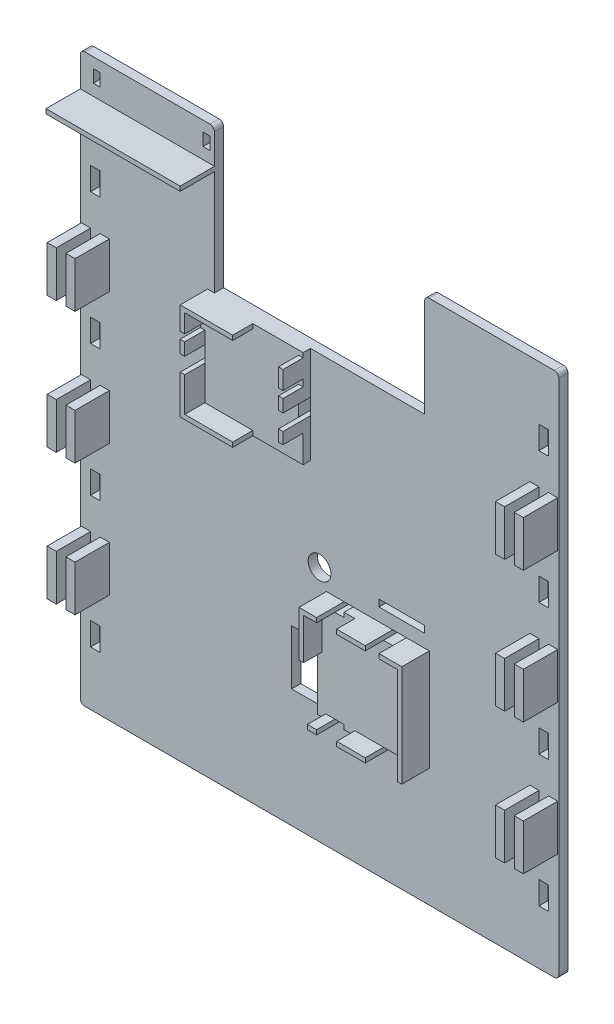
from build123d import *

# Parameters (mm, degrees)
SKETCH1_W               = 200
SKETCH1_H               = 230
BOSS_EXTRUDE1_DEPTH     = 70
SKETCH2_W               = 192
SKETCH2_H               = 222
CUT_EXTRUDE1_DEPTH      = 66
SKETCH4_W               = 196
SKETCH4_H               = 25
CUT_EXTRUDE3_DEPTH      = 10
SKETCH10_R              = 5
CUT_EXTRUDE8_DEPTH      = 167.075284133
SKETCH11_W              = 2
SKETCH11_H              = 10
BOSS_EXTRUDE2_DEPTH     = 20
SKETCH12_W              = 2
SKETCH12_H              = 5
CUT_EXTRUDE9_DEPTH      = 20
FILLET1_R               = 2.5
SKETCH13_W              = 2
SKETCH13_H              = 10
BOSS_EXTRUDE3_DEPTH     = 20
SKETCH14_W              = 2
SKETCH14_H              = 5
CUT_EXTRUDE10_DEPTH     = 20
FILLET2_R               = 2.5
SKETCH15_W              = 192
SKETCH15_H              = 66
CUT_EXTRUDE11_DEPTH     = 267.458251889
BOSS_EXTRUDE4_DEPTH     = 2
SKETCH18_R              = 5
CUT_EXTRUDE12_DEPTH     = 248.638849941
SKETCH19_R              = 5
CUT_EXTRUDE13_DEPTH     = 248.638849941
SKETCH20_R              = 5
CUT_EXTRUDE14_DEPTH     = 248.638849941
BOSS_EXTRUDE5_START     = 2
BOSS_EXTRUDE5_DEPTH     = 2
SKETCH21_W              = 20
SKETCH21_H              = 10
CUT_EXTRUDE15_DEPTH     = 248.638849941
SKETCH22_W              = 92
SKETCH22_H              = 45
CUT_EXTRUDE16_DEPTH     = 10
SKETCH24_R              = 5.1
CUT_EXTRUDE18_DEPTH     = 242.091269025
FILLET3_R               = 20
FILLET4_R               = 20
SKETCH31_W              = 4
SKETCH31_H              = 230
CUT_EXTRUDE24_DEPTH     = 168.705098312
SKETCH33_W              = 15
SKETCH33_H              = 20
BOSS_EXTRUDE7_DEPTH     = 4
SKETCH34_W              = 4
SKETCH34_H              = 23.75
BOSS_EXTRUDE8_DEPTH     = 4.2
SKETCH35_W              = 4
SKETCH35_H              = 47.5
BOSS_EXTRUDE9_DEPTH     = 4.2
SKETCH37_W              = 15
SKETCH37_H              = 20
BOSS_EXTRUDE10_DEPTH    = 4
SKETCH39_W              = 4
SKETCH39_H              = 47.5
BOSS_EXTRUDE11_DEPTH    = 4.2
SKETCH32_W              = 4
SKETCH32_H              = 230
CUT_EXTRUDE25_DEPTH     = 168.824432071
SKETCH40_W              = 4
SKETCH40_H              = 230
BOSS_EXTRUDE12_DEPTH    = 4.5
MIRROR8_COPY_1_SKETCH_W = 15
MIRROR8_COPY_1_SKETCH_H = 20
MIRROR8_COPY_1_DEPTH    = 4
MIRROR9_COPY_1_SKETCH_W = 4
MIRROR9_COPY_1_SKETCH_H = 47.5
MIRROR9_COPY_1_DEPTH    = 4.2
MIRROR9_COPY_2_SKETCH_W = 15
MIRROR9_COPY_2_SKETCH_H = 20
MIRROR9_COPY_2_DEPTH    = 4
MIRROR9_COPY_3_SKETCH_W = 4
MIRROR9_COPY_3_SKETCH_H = 23.75
MIRROR9_COPY_3_DEPTH    = 4.2
MIRROR9_COPY_4_SKETCH_W = 15
MIRROR9_COPY_4_SKETCH_H = 20
MIRROR9_COPY_4_DEPTH    = 4
MIRROR9_COPY_5_SKETCH_W = 15
MIRROR9_COPY_5_SKETCH_H = 20
MIRROR9_COPY_5_DEPTH    = 4
MIRROR9_COPY_6_SKETCH_W = 15
MIRROR9_COPY_6_SKETCH_H = 20
MIRROR9_COPY_6_DEPTH    = 4
SKETCH65_W              = 45
SKETCH65_H              = 42.5
SKETCH65_W_2            = 41
SKETCH65_H_2            = 38.5
BOSS_EXTRUDE23_DEPTH    = 12
CUT_EXTRUDE39_DEPTH     = 8.8
SKETCH67_W              = 2
SKETCH67_H              = 3
CUT_EXTRUDE40_DEPTH     = 8.8
SKETCH68_W              = 22
SKETCH68_H              = 2
SKETCH68_W_2            = 2
SKETCH68_H_2            = 3
CUT_EXTRUDE41_DEPTH     = 8.8
SKETCH69_W              = 2
SKETCH69_H              = 7
CUT_EXTRUDE42_DEPTH     = 157.342860406
SKETCH70_W              = 41
SKETCH70_H              = 38.5
BOSS_EXTRUDE24_DEPTH    = 3.2
SKETCH72_W              = 58.7
SKETCH72_H              = 4
BOSS_EXTRUDE25_DEPTH    = 18
SKETCH73_W              = 58.7
SKETCH73_H              = 2
BOSS_EXTRUDE26_DEPTH    = 15
FILLET5_R               = 2
SKETCH74_W              = 3
SKETCH74_H              = 5.5
CUT_EXTRUDE43_DEPTH     = 170.929661919
SKETCH75_W              = 45
SKETCH75_H              = 44.5
BOSS_EXTRUDE27_DEPTH    = 4
SKETCH76_W              = 18.5
SKETCH76_H              = 2
SKETCH76_W_2            = 8
BOSS_EXTRUDE28_DEPTH    = 8
SKETCH77_W              = 15
SKETCH77_H              = 24
CUT_EXTRUDE44_DEPTH     = 170.929661919
SKETCH78_W              = 20
SKETCH78_H              = 3
CUT_EXTRUDE45_DEPTH     = 170.929661919
SKETCH79_W              = 6
SKETCH79_H              = 2
SKETCH79_W_2            = 4
CUT_EXTRUDE46_DEPTH     = 171.020851662


with BuildPart() as part:
    # Sketch1 → Boss-Extrude1 (new body)
    with BuildSketch(Plane.XY):
        Rectangle(SKETCH1_W, SKETCH1_H)
    extrude(amount=BOSS_EXTRUDE1_DEPTH)

    # Sketch2 → Cut-Extrude1 (cut)
    with BuildSketch(Plane.XY.offset(70)):
        Rectangle(SKETCH2_W, SKETCH2_H)
    extrude(amount=-CUT_EXTRUDE1_DEPTH, mode=Mode.SUBTRACT)

    # Sketch4 → Cut-Extrude3 (cut)
    with BuildSketch(Plane.XZ.offset(115)):
        with Locations((0, 57.5)):
            Rectangle(SKETCH4_W, SKETCH4_H)
    extrude(amount=-CUT_EXTRUDE3_DEPTH, mode=Mode.SUBTRACT)

    # Sketch10 → Cut-Extrude8 (cut, through all)
    with BuildSketch(Plane.XY.offset(4)):
        with Locations((0, -11)):
            Circle(SKETCH10_R)
    extrude(amount=-CUT_EXTRUDE8_DEPTH, mode=Mode.SUBTRACT)

    # Sketch11 → Boss-Extrude2 (add)
    with BuildSketch(Plane.XY.offset(70)):
        with Locations((-99, -110)):
            Rectangle(SKETCH11_W, SKETCH11_H)
    extrude(amount=BOSS_EXTRUDE2_DEPTH)

    # Sketch12 → Cut-Extrude9 (cut)
    with BuildSketch(Plane.XY.offset(90)):
        with Locations((-99, -110)):
            Rectangle(SKETCH12_W, SKETCH12_H)
    extrude(amount=-CUT_EXTRUDE9_DEPTH, mode=Mode.SUBTRACT)

    # Fillet1
    fillet1_edges = [part.edges().sort_by_distance(p)[0] for p in [
        (-99, -112.5, 70),
        (-99, -107.5, 70),
    ]]
    fillet(fillet1_edges, radius=FILLET1_R - 0.0001)  # a hair under: the kernel refuses the full size

    # Sketch13 → Boss-Extrude3 (add)
    with BuildSketch(Plane.XY.offset(70)):
        with Locations((99, -110)):
            Rectangle(SKETCH13_W, SKETCH13_H)
    extrude(amount=BOSS_EXTRUDE3_DEPTH)

    # Sketch14 → Cut-Extrude10 (cut)
    with BuildSketch(Plane.XY.offset(90)):
        with Locations((99, -110)):
            Rectangle(SKETCH14_W, SKETCH14_H)
    extrude(amount=-CUT_EXTRUDE10_DEPTH, mode=Mode.SUBTRACT)

    # Fillet2
    fillet2_edges = [part.edges().sort_by_distance(p)[0] for p in [
        (99, -112.5, 70),
        (99, -107.5, 70),
    ]]
    fillet(fillet2_edges, radius=FILLET2_R - 0.0001)  # a hair under: the kernel refuses the full size

    # Sketch15 → Cut-Extrude11 (cut, through all)
    with BuildSketch(Plane(origin=(0, 115, 0), x_dir=(1, 0, 0), z_dir=(0, 1, 0))):
        with Locations((0, -37)):
            Rectangle(SKETCH15_W, SKETCH15_H)
    extrude(amount=-CUT_EXTRUDE11_DEPTH, mode=Mode.SUBTRACT)

    # Sketch16 → Boss-Extrude4 (add)
    with BuildSketch(Plane(origin=(-98, 0, 0), x_dir=(0, 0, -1), z_dir=(1, 0, 0))):
        with BuildLine():
            Line((-90, -107.5), (-72.5, -107.5))
            ThreePointArc((-72.5, -107.5), (-70, -110), (-72.5, -112.5))
            Line((-72.5, -112.5), (-90, -112.5))
            Line((-90, -112.5), (-90, -115))
            Line((-90, -115), (-45, -115))
            Line((-45, -115), (-45, -105))
            Line((-45, -105), (-90, -105))
            Line((-90, -105), (-90, -107.5))
        make_face()
    extrude(amount=BOSS_EXTRUDE4_DEPTH)

    # Sketch18 → Cut-Extrude12 (cut, through all)
    with BuildSketch(Plane(origin=(100, 0, 0), x_dir=(0, 0, -1), z_dir=(1, 0, 0))):
        with Locations((-43, -35)):
            Circle(SKETCH18_R)
    extrude(amount=-CUT_EXTRUDE12_DEPTH, mode=Mode.SUBTRACT)

    # Sketch19 → Cut-Extrude13 (cut, through all)
    with BuildSketch(Plane(origin=(100, 0, 0), x_dir=(0, 0, -1), z_dir=(1, 0, 0))):
        with Locations((-15, -95)):
            Circle(SKETCH19_R)
    extrude(amount=-CUT_EXTRUDE13_DEPTH, mode=Mode.SUBTRACT)

    # Sketch20 → Cut-Extrude14 (cut, through all)
    with BuildSketch(Plane(origin=(100, 0, 0), x_dir=(0, 0, -1), z_dir=(1, 0, 0))):
        with Locations((-15, 95)):
            Circle(SKETCH20_R)
    extrude(amount=-CUT_EXTRUDE14_DEPTH, mode=Mode.SUBTRACT)

    # Sketch17 → Boss-Extrude5 (add)
    with BuildSketch(Plane.ZY.offset(-98).offset(BOSS_EXTRUDE5_START)):
        with BuildLine():
            Line((90, -107.5), (72.5, -107.5))
            ThreePointArc((72.5, -107.5), (70, -110), (72.5, -112.5))
            Line((72.5, -112.5), (90, -112.5))
            Line((90, -112.5), (90, -115))
            Line((90, -115), (45, -115))
            Line((45, -115), (45, -105))
            Line((45, -105), (90, -105))
            Line((90, -105), (90, -107.5))
        make_face()
    extrude(amount=-BOSS_EXTRUDE5_DEPTH)

    # Sketch21 → Cut-Extrude15 (cut, through all)
    with BuildSketch(Plane(origin=(100, 0, 0), x_dir=(0, 0, -1), z_dir=(1, 0, 0))):
        with Locations((-80, -110)):
            Rectangle(SKETCH21_W, SKETCH21_H)
    extrude(amount=-CUT_EXTRUDE15_DEPTH, mode=Mode.SUBTRACT)

    # Sketch22 → Cut-Extrude16 (cut)
    with BuildSketch(Plane.XY.offset(4)):
        with Locations((0, 92.5)):
            Rectangle(SKETCH22_W, SKETCH22_H)
    extrude(amount=-CUT_EXTRUDE16_DEPTH, mode=Mode.SUBTRACT)

    # Sketch24 → Cut-Extrude18 (cut, through all)
    with BuildSketch(Plane(origin=(100, 0, 0), x_dir=(0, 0, -1), z_dir=(1, 0, 0))):
        with Locations((-52.45, -102)):
            Circle(SKETCH24_R)
    extrude(amount=-CUT_EXTRUDE18_DEPTH, mode=Mode.SUBTRACT)

    # Fillet3
    fillet3_edges = [part.edges().sort_by_distance(p)[0] for p in [
        (98, -115, 70),
    ]]
    fillet(fillet3_edges, radius=FILLET3_R)

    # Fillet4
    fillet4_edges = [part.edges().sort_by_distance(p)[0] for p in [
        (-98, -115, 70),
    ]]
    fillet(fillet4_edges, radius=FILLET4_R)

    # Sketch31 → Cut-Extrude24 (cut, through all)
    with BuildSketch(Plane.XY.offset(70)):
        with Locations((98, 0)):
            Rectangle(SKETCH31_W, SKETCH31_H)
    extrude(amount=-CUT_EXTRUDE24_DEPTH, mode=Mode.SUBTRACT)

    # Sketch33 → Boss-Extrude7 (add)
    with BuildSketch(Plane(origin=(96, 0, 0), x_dir=(0, 0, -1), z_dir=(1, 0, 0))):
        with Locations((-11.5, -57.5)):
            Rectangle(SKETCH33_W, SKETCH33_H)
    boss_extrude7 = extrude(amount=-BOSS_EXTRUDE7_DEPTH)

    # Sketch34 → Boss-Extrude8 (add)
    with BuildSketch(Plane(origin=(96, 0, 0), x_dir=(0, 0, -1), z_dir=(1, 0, 0))):
        with Locations((-2, -103.125)):
            Rectangle(SKETCH34_W, SKETCH34_H)
    boss_extrude8 = extrude(amount=BOSS_EXTRUDE8_DEPTH)

    # Sketch35 → Boss-Extrude9 (add)
    with BuildSketch(Plane(origin=(96, 0, 0), x_dir=(0, 0, -1), z_dir=(1, 0, 0))):
        with Locations((-2, -57.5)):
            Rectangle(SKETCH35_W, SKETCH35_H)
    boss_extrude9 = extrude(amount=BOSS_EXTRUDE9_DEPTH)

    # Sketch37 → Boss-Extrude10 (add)
    with BuildSketch(Plane(origin=(96, 0, 0), x_dir=(0, 0, -1), z_dir=(1, 0, 0))):
        with Locations((-11.5, 0)):
            Rectangle(SKETCH37_W, SKETCH37_H)
    boss_extrude10 = extrude(amount=-BOSS_EXTRUDE10_DEPTH)

    # Sketch39 → Boss-Extrude11 (add)
    with BuildSketch(Plane(origin=(96, 0, 0), x_dir=(0, 0, -1), z_dir=(1, 0, 0))):
        with Locations((-2, 0)):
            Rectangle(SKETCH39_W, SKETCH39_H)
    boss_extrude11 = extrude(amount=BOSS_EXTRUDE11_DEPTH)

    # Sketch32 → Cut-Extrude25 (cut, through all)
    with BuildSketch(Plane.XY.offset(70)):
        with Locations((-98, 0)):
            Rectangle(SKETCH32_W, SKETCH32_H)
    extrude(amount=-CUT_EXTRUDE25_DEPTH, mode=Mode.SUBTRACT)

    # Mirror3: Boss-Extrude9 across plane
    add(boss_extrude9.mirror(Plane(origin=(0, 0, 0), x_dir=(0, 0, 1), z_dir=(0, -1, 0))))

    # Mirror5: Boss-Extrude7 across plane
    add(boss_extrude7.mirror(Plane(origin=(0, 0, 0), x_dir=(0, 0, 1), z_dir=(0, -1, 0))))

    # Mirror6: Boss-Extrude8 across plane
    add(boss_extrude8.mirror(Plane(origin=(0, 0, 0), x_dir=(0, 0, 1), z_dir=(0, -1, 0))))

    # Sketch40 → Boss-Extrude12 (add)
    with BuildSketch(Plane(origin=(100.2, 0, 0), x_dir=(0, 0, -1), z_dir=(1, 0, 0))):
        with Locations((-2, 0)):
            Rectangle(SKETCH40_W, SKETCH40_H)
    boss_extrude12 = extrude(amount=BOSS_EXTRUDE12_DEPTH)

    # Mirror8: Boss-Extrude7, Boss-Extrude10 across plane
    add(boss_extrude7.mirror(Plane(origin=(98.1, 0, 0), x_dir=(0, 0, 1), z_dir=(1, 0, 0))))
    add(boss_extrude10.mirror(Plane(origin=(98.1, 0, 0), x_dir=(0, 0, 1), z_dir=(1, 0, 0))))

    # Mirror8 copy 1 sketch → Mirror8 copy 1 (add)
    with BuildSketch(Plane(origin=(100.2, 0, 0), x_dir=(0, 0, -1), z_dir=(-1, 0, 0))):
        with Locations((-11.5, -57.5)):
            Rectangle(MIRROR8_COPY_1_SKETCH_W, MIRROR8_COPY_1_SKETCH_H)
    extrude(amount=-MIRROR8_COPY_1_DEPTH)

    # Mirror9: Boss-Extrude7, Boss-Extrude8, Boss-Extrude9, Boss-Extrude10, Boss-Extrude11, Boss-Extrude12 across plane
    add(boss_extrude7.mirror(Plane.ZY))
    add(boss_extrude8.mirror(Plane.ZY))
    add(boss_extrude9.mirror(Plane.ZY))
    add(boss_extrude10.mirror(Plane.ZY))
    add(boss_extrude11.mirror(Plane.ZY))
    add(boss_extrude12.mirror(Plane.ZY))

    # Mirror9 copy 1 sketch → Mirror9 copy 1 (add)
    with BuildSketch(Plane(origin=(-96, 0, 0), x_dir=(0, 0, -1), z_dir=(-1, 0, 0))):
        with Locations((-2, -57.5)):
            Rectangle(MIRROR9_COPY_1_SKETCH_W, MIRROR9_COPY_1_SKETCH_H)
    extrude(amount=MIRROR9_COPY_1_DEPTH)

    # Mirror9 copy 2 sketch → Mirror9 copy 2 (add)
    with BuildSketch(Plane(origin=(-96, 0, 0), x_dir=(0, 0, -1), z_dir=(-1, 0, 0))):
        with Locations((-11.5, -57.5)):
            Rectangle(MIRROR9_COPY_2_SKETCH_W, MIRROR9_COPY_2_SKETCH_H)
    extrude(amount=-MIRROR9_COPY_2_DEPTH)

    # Mirror9 copy 3 sketch → Mirror9 copy 3 (add)
    with BuildSketch(Plane(origin=(-96, 0, 0), x_dir=(0, 0, -1), z_dir=(-1, 0, 0))):
        with Locations((-2, -103.125)):
            Rectangle(MIRROR9_COPY_3_SKETCH_W, MIRROR9_COPY_3_SKETCH_H)
    extrude(amount=MIRROR9_COPY_3_DEPTH)

    # Mirror9 copy 4 sketch → Mirror9 copy 4 (add)
    with BuildSketch(Plane(origin=(-100.2, 0, 0), x_dir=(0, 0, -1), z_dir=(1, 0, 0))):
        with Locations((-11.5, -57.5)):
            Rectangle(MIRROR9_COPY_4_SKETCH_W, MIRROR9_COPY_4_SKETCH_H)
    extrude(amount=-MIRROR9_COPY_4_DEPTH)

    # Mirror9 copy 5 sketch → Mirror9 copy 5 (add)
    with BuildSketch(Plane(origin=(-100.2, 0, 0), x_dir=(0, 0, -1), z_dir=(1, 0, 0))):
        with Locations((-11.5, 0)):
            Rectangle(MIRROR9_COPY_5_SKETCH_W, MIRROR9_COPY_5_SKETCH_H)
    extrude(amount=-MIRROR9_COPY_5_DEPTH)

    # Mirror9 copy 6 sketch → Mirror9 copy 6 (add)
    with BuildSketch(Plane(origin=(-100.2, 0, 0), x_dir=(0, 0, -1), z_dir=(1, 0, 0))):
        with Locations((-11.5, 57.5)):
            Rectangle(MIRROR9_COPY_6_SKETCH_W, MIRROR9_COPY_6_SKETCH_H)
    extrude(amount=-MIRROR9_COPY_6_DEPTH)

    # Sketch65 → Boss-Extrude23 (add)
    with BuildSketch(Plane.XY.offset(4)):
        with Locations((-26.5, 48.75)):
            Rectangle(SKETCH65_W, SKETCH65_H)
        with Locations((-26.5, 48.75)):
            Rectangle(SKETCH65_W_2, SKETCH65_H_2, mode=Mode.SUBTRACT)
    extrude(amount=BOSS_EXTRUDE23_DEPTH)

    # Sketch66 → Cut-Extrude39 (cut)
    with BuildSketch(Plane.XY.offset(16)):
        Polygon((-4, 27.5), (-26, 27.5), (-26, 29.5), (-6, 29.5), (-6, 39.5), (-4, 39.5), align=None)
    extrude(amount=-CUT_EXTRUDE39_DEPTH, mode=Mode.SUBTRACT)

    # Sketch67 → Cut-Extrude40 (cut)
    with BuildSketch(Plane.XY.offset(16)):
        with Locations((-5, 58.5)):
            Rectangle(SKETCH67_W, SKETCH67_H)
    extrude(amount=-CUT_EXTRUDE40_DEPTH, mode=Mode.SUBTRACT)

    # Sketch68 → Cut-Extrude41 (cut)
    with BuildSketch(Plane.XY.offset(16)):
        with Locations((-15, 69)):
            Rectangle(SKETCH68_W, SKETCH68_H)
        with Locations((-48, 58.5)):
            Rectangle(SKETCH68_W_2, SKETCH68_H_2)
    extrude(amount=-CUT_EXTRUDE41_DEPTH, mode=Mode.SUBTRACT)

    # Sketch69 → Cut-Extrude42 (cut, through all)
    with BuildSketch(Plane.XY.offset(16)):
        with Locations((-5, 48)):
            Rectangle(SKETCH69_W, SKETCH69_H)
        with Locations((-48, 48)):
            Rectangle(SKETCH69_W, SKETCH69_H)
    extrude(amount=-CUT_EXTRUDE42_DEPTH, mode=Mode.SUBTRACT)

    # Sketch70 → Boss-Extrude24 (add)
    with BuildSketch(Plane.XY.offset(4)):
        with Locations((-26.5, 48.75)):
            Rectangle(SKETCH70_W, SKETCH70_H)
    extrude(amount=BOSS_EXTRUDE24_DEPTH)

    # Sketch72 → Boss-Extrude25 (add)
    with BuildSketch(Plane(origin=(0, 115, 0), x_dir=(1, 0, 0), z_dir=(0, 1, 0))):
        with Locations((-75.35, -2)):
            Rectangle(SKETCH72_W, SKETCH72_H)
    extrude(amount=BOSS_EXTRUDE25_DEPTH)

    # Sketch73 → Boss-Extrude26 (add)
    with BuildSketch(Plane.XY.offset(4)):
        with Locations((-75.35, 117)):
            Rectangle(SKETCH73_W, SKETCH73_H)
    extrude(amount=BOSS_EXTRUDE26_DEPTH)

    # Fillet5
    fillet5_edges = [part.edges().sort_by_distance(p)[0] for p in [
        (46, 115, 2),
        (104.7, -115, 2),
        (104.7, 115, 2),
        (-104.7, -115, 2),
        (-46, 133, 2),
        (-104.7, 133, 2),
    ]]
    fillet(fillet5_edges, radius=FILLET5_R)

    # Sketch74 → Cut-Extrude43 (cut, through all)
    with BuildSketch(Plane.XY.offset(4)):
        with Locations((-97.5, 125.75)):
            Rectangle(SKETCH74_W, SKETCH74_H)
        with Locations((-49.5, 125.75)):
            Rectangle(SKETCH74_W, SKETCH74_H)
    extrude(amount=-CUT_EXTRUDE43_DEPTH, mode=Mode.SUBTRACT)

    # Sketch75 → Boss-Extrude27 (add)
    with BuildSketch(Plane.XY.offset(4)):
        with Locations((25.5, -40.89)):
            Rectangle(SKETCH75_W, SKETCH75_H)
    extrude(amount=BOSS_EXTRUDE27_DEPTH)

    # Sketch76 → Boss-Extrude28 (add)
    with BuildSketch(Plane.XY.offset(8)):
        Polygon((48, -63.14), (48, -18.64), (19.5, -18.64), (19.5, -20.64), (46, -20.64), (46, -63.14), align=None)
        Polygon((13, -18.64), (13, -20.64), (5, -20.64), (5, -38.64), (3, -38.64), (3, -18.64), align=None)
        with Locations((28.75, -62.14)):
            Rectangle(SKETCH76_W, SKETCH76_H)
        with Locations((10.7, -62.14)):
            Rectangle(SKETCH76_W_2, SKETCH76_H)
    extrude(amount=BOSS_EXTRUDE28_DEPTH)

    # Sketch77 → Cut-Extrude44 (cut, through all)
    with BuildSketch(Plane.XY.offset(4)):
        with Locations((-4.726589232, -51.14)):
            Rectangle(SKETCH77_W, SKETCH77_H)
    extrude(amount=-CUT_EXTRUDE44_DEPTH, mode=Mode.SUBTRACT)

    # Sketch78 → Cut-Extrude45 (cut, through all)
    with BuildSketch(Plane.XY.offset(4)):
        with Locations((36, -11.5)):
            Rectangle(SKETCH78_W, SKETCH78_H)
    extrude(amount=-CUT_EXTRUDE45_DEPTH, mode=Mode.SUBTRACT)

    # Sketch79 → Cut-Extrude46 (cut, through all)
    with BuildSketch(Plane.XY.offset(16)):
        with Locations((35, -19.64)):
            Rectangle(SKETCH79_W, SKETCH79_H)
        with Locations((35, -62.14)):
            Rectangle(SKETCH79_W, SKETCH79_H)
        with Locations((12.7, -62.14)):
            Rectangle(SKETCH79_W_2, SKETCH79_H)
        with Locations((12.7, -19.64)):
            Rectangle(SKETCH79_W_2, SKETCH79_H)
    extrude(amount=-CUT_EXTRUDE46_DEPTH, mode=Mode.SUBTRACT)


solid = part.part
